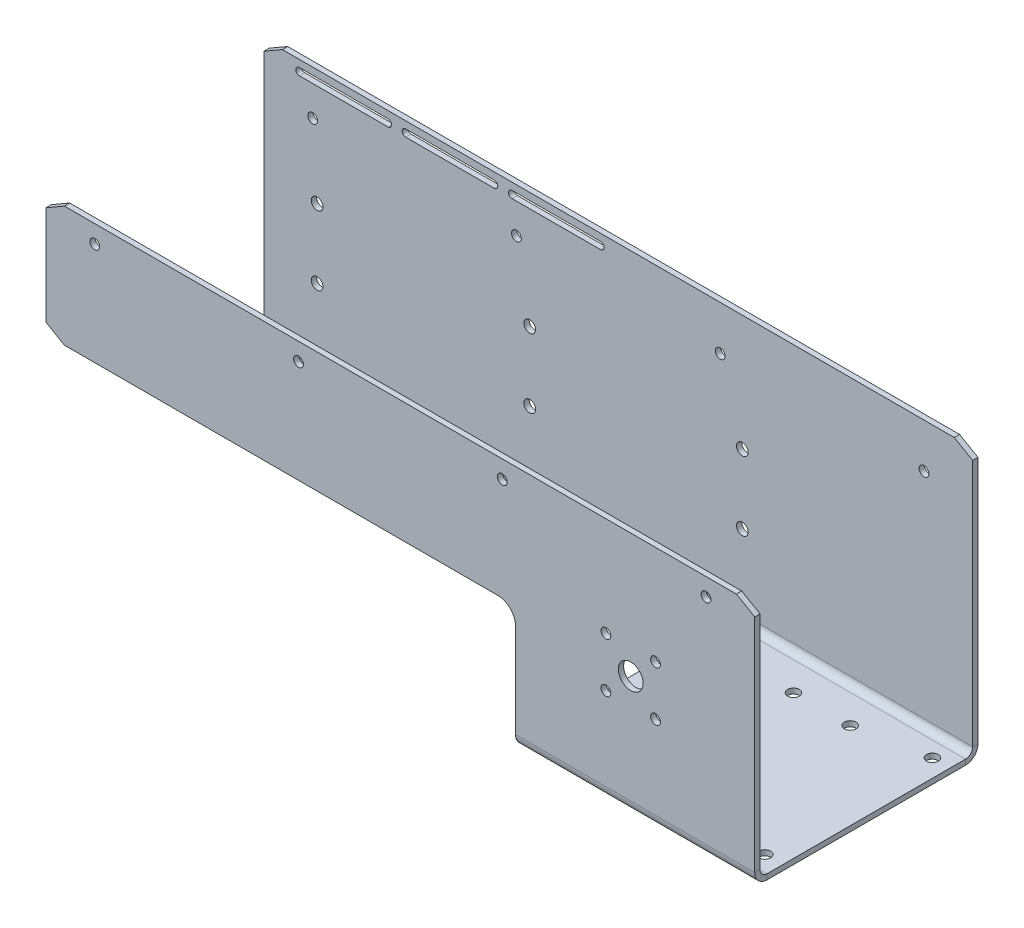
from build123d import *
from OCP.BRepFilletAPI import BRepFilletAPI_MakeChamfer

# Parameters (mm, degrees)
ODGI_CIE_BAZOWE1_DEPTH     = 200
SZKIC25_W                  = 265
SZKIC25_H                  = 70
WYTNIJ_WYCI_GNI_CIE2_DEPTH = 94
SFAZOWANIE1_SIZE           = 6
SFAZOWANIE1_SIZE2          = 10.392304845
ZAOKR_GLENIE1_R            = 10
OTW_R_POD_RUB_M51_D        = 5.5
OTW_R_POD_RUB_M51_DEPTH    = 3
OTW_R_POD_RUB_M61_D        = 6.6
OTW_R_POD_RUB_M61_DEPTH    = 3
OTW_R_POD_RUB_M52_D        = 5.5
OTW_R_POD_RUB_M62_D        = 6.6
OTW_R_POD_RUB_M62_DEPTH    = 10
OTW_R_POD_RUB_M62_TIP      = 1.982840043
WYTNIJ_WYCI_GNI_CIE3_REACH = 281.957
SZKIC48_R                  = 7
WYTNIJ_WYCI_GNI_CIE4_DEPTH = 10


# Sheet-metal steps are written as plain solids
with BuildPart() as part:
    # Szkic1 → Odgięcie bazowe1 (new, symmetric)
    with BuildSketch(Plane(origin=(0, 0, 0), x_dir=(0, 0, -1), z_dir=(1, 0, 0))):
        with BuildLine():
            Line((-60, 135), (-60, 4))
            ThreePointArc((-60, 4), (-58.828427125, 1.171572875), (-56, 0))
            Line((-56, 0), (56, 0))
            ThreePointArc((56, 0), (58.828427125, 1.171572875), (60, 4))
            Line((60, 4), (60, 150))
            Line((60, 150), (63, 150))
            Line((63, 150), (63, 4))
            ThreePointArc((63, 4), (60.949747468, -0.949747468), (56, -3))
            Line((56, -3), (-56, -3))
            ThreePointArc((-56, -3), (-60.949747468, -0.949747468), (-63, 4))
            Line((-63, 4), (-63, 135))
            Line((-63, 135), (-60, 135))
        make_face()
    extrude(amount=ODGI_CIE_BAZOWE1_DEPTH, both=True)

    # Szkic25 → Wytnij-wyciągnięcie2 (cut)
    with BuildSketch(Plane.XY.offset(63)):
        with Locations((-67.5, 32)):
            Rectangle(SZKIC25_W, SZKIC25_H)
    extrude(amount=-WYTNIJ_WYCI_GNI_CIE2_DEPTH, mode=Mode.SUBTRACT)

    # Sfazowanie1: one chamfer whose edges measure the first distance from different faces: ONE call of the kernel's chamfer builder (chamfer() names one face for all edges)
    sfazowanie1_edges_1 = [part.edges().sort_by_distance(p)[0] for p in [
        (-200, 150, -61.5),
        (-200, -1.5, -31),
    ]]
    sfazowanie1_side_1 = [part.faces().sort_by_distance(p)[0] for p in [
        (-200, -1.436894117, -43.5),
    ]]
    sfazowanie1_edges_2 = [part.edges().sort_by_distance(p)[0] for p in [
        (-200, 135, 61.5),
        (-200, 67, 61.5),
    ]]
    sfazowanie1_side_2 = [part.faces().sort_by_distance(p)[0] for p in [
        (-200, 101, 61.5),
    ]]
    sfazowanie1_edges_3 = [part.edges().sort_by_distance(p)[0] for p in [
        (200, 150, -61.5),
        (200, 135, 61.5),
    ]]
    sfazowanie1_side_3 = [part.faces().sort_by_distance(p)[0] for p in [
        (200, 0.451769567, 59.548230433),
    ]]
    sfazowanie1 = BRepFilletAPI_MakeChamfer(part.part.solid().wrapped)
    for e in sfazowanie1_edges_1:
        sfazowanie1.Add(SFAZOWANIE1_SIZE, SFAZOWANIE1_SIZE2, e.wrapped, sfazowanie1_side_1[0].wrapped)  # the first distance lies on this face
    for e in sfazowanie1_edges_2:
        sfazowanie1.Add(SFAZOWANIE1_SIZE, SFAZOWANIE1_SIZE2, e.wrapped, sfazowanie1_side_2[0].wrapped)  # the first distance lies on this face
    for e in sfazowanie1_edges_3:
        sfazowanie1.Add(SFAZOWANIE1_SIZE, SFAZOWANIE1_SIZE2, e.wrapped, sfazowanie1_side_3[0].wrapped)  # the first distance lies on this face
    add(Compound.cast(sfazowanie1.Shape()), mode=Mode.REPLACE)

    # Zaokrąglenie1
    zaokr_glenie1_edges = [part.edges().sort_by_distance(p)[0] for p in [
        (65, -1.5, -31),
        (65, 67, 61.5),
    ]]
    fillet(zaokr_glenie1_edges, radius=ZAOKR_GLENIE1_R)

    # Otwór pod śrubę M51
    with Locations(Plane.XY.offset(63)):
        with Locations((144, 79), (116, 79), (144, 51), (116, 51), (130, 65)):
            Hole(OTW_R_POD_RUB_M51_D / 2, depth=OTW_R_POD_RUB_M51_DEPTH)

    # Otwór pod śrubę M61
    with Locations(Plane(origin=(0, 0, -63), x_dir=(-1, 0, 0), z_dir=(0, 0, -1))):
        with Locations((-70, 84.5), (-70, 45.5), (50, 84.5), (50, 45.5), (170, 84.5), (170, 45.5)):
            Hole(OTW_R_POD_RUB_M61_D / 2, depth=OTW_R_POD_RUB_M61_DEPTH)

    # Otwór pod śrubę M52 (through all)
    with Locations(Plane(origin=(0, 0, -63), x_dir=(-1, 0, 0), z_dir=(0, 0, -1))):
        with Locations((-172.5, 125), (-57.5, 125), (57.5, 125), (172.5, 125)):
            Hole(OTW_R_POD_RUB_M52_D / 2)

    # Otwór pod śrubę M62
    with Locations(Plane(origin=(0, -3, 0), x_dir=(-1, 0, 0), z_dir=(0, -1, 0))):
        with Locations((-190, 47.25), (-80, 47.25), (-151, 39.85), (-119, 39.85), (-190, -47.25), (-151, -39.85), (-119, -39.85), (-80, -47.25)):
            Hole(OTW_R_POD_RUB_M62_D / 2, depth=OTW_R_POD_RUB_M62_DEPTH)
            with Locations((0, 0, -(OTW_R_POD_RUB_M62_DEPTH + OTW_R_POD_RUB_M62_TIP / 2))):  # 118° drill point
                Cone(0, OTW_R_POD_RUB_M62_D / 2, OTW_R_POD_RUB_M62_TIP, mode=Mode.SUBTRACT)

    # Szkic43 → Wytnij-wyciągnięcie3 (cut, up to next)
    with BuildSketch(Plane(origin=(0, 0, -63), x_dir=(-1, 0, 0), z_dir=(0, 0, -1)), mode=Mode.PRIVATE) as wytnij_wyci_gni_cie3_sk1:
        with BuildLine():
            Line((130, 146), (180, 146))
            ThreePointArc((180, 146), (182, 144), (180, 142))
            Line((180, 142), (130, 142))
            ThreePointArc((130, 142), (128, 144), (130, 146))
        make_face()
    wytnij_wyci_gni_cie3_tool1 = extrude(wytnij_wyci_gni_cie3_sk1.sketch, amount=-WYTNIJ_WYCI_GNI_CIE3_REACH, mode=Mode.PRIVATE) & part.part
    # Szkic43 → Wytnij-wyciągnięcie3 (cut, up to next)
    with BuildSketch(Plane(origin=(0, 0, -63), x_dir=(-1, 0, 0), z_dir=(0, 0, -1)), mode=Mode.PRIVATE) as wytnij_wyci_gni_cie3_sk2:
        with BuildLine():
            Line((70, 146), (120, 146))
            ThreePointArc((120, 146), (122, 144), (120, 142))
            Line((120, 142), (70, 142))
            ThreePointArc((70, 142), (68, 144), (70, 146))
        make_face()
    wytnij_wyci_gni_cie3_tool2 = extrude(wytnij_wyci_gni_cie3_sk2.sketch, amount=-WYTNIJ_WYCI_GNI_CIE3_REACH, mode=Mode.PRIVATE) & part.part
    # Szkic43 → Wytnij-wyciągnięcie3 (cut, up to next)
    with BuildSketch(Plane(origin=(0, 0, -63), x_dir=(-1, 0, 0), z_dir=(0, 0, -1)), mode=Mode.PRIVATE) as wytnij_wyci_gni_cie3_sk3:
        with BuildLine():
            Line((10, 146), (60, 146))
            ThreePointArc((60, 146), (62, 144), (60, 142))
            Line((60, 142), (10, 142))
            ThreePointArc((10, 142), (8, 144), (10, 146))
        make_face()
    wytnij_wyci_gni_cie3_tool3 = extrude(wytnij_wyci_gni_cie3_sk3.sketch, amount=-WYTNIJ_WYCI_GNI_CIE3_REACH, mode=Mode.PRIVATE) & part.part
    add(wytnij_wyci_gni_cie3_tool1.solids().sort_by_distance((-155, 144, -63))[0], mode=Mode.SUBTRACT)
    add(wytnij_wyci_gni_cie3_tool2.solids().sort_by_distance((-95, 144, -63))[0], mode=Mode.SUBTRACT)
    add(wytnij_wyci_gni_cie3_tool3.solids().sort_by_distance((-35, 144, -63))[0], mode=Mode.SUBTRACT)

    # Szkic48 → Wytnij-wyciągnięcie4 (cut)
    with BuildSketch(Plane.XY.offset(63)):
        with Locations((130, 65)):
            Circle(SZKIC48_R)
    extrude(amount=-WYTNIJ_WYCI_GNI_CIE4_DEPTH, mode=Mode.SUBTRACT)


solid = part.part
